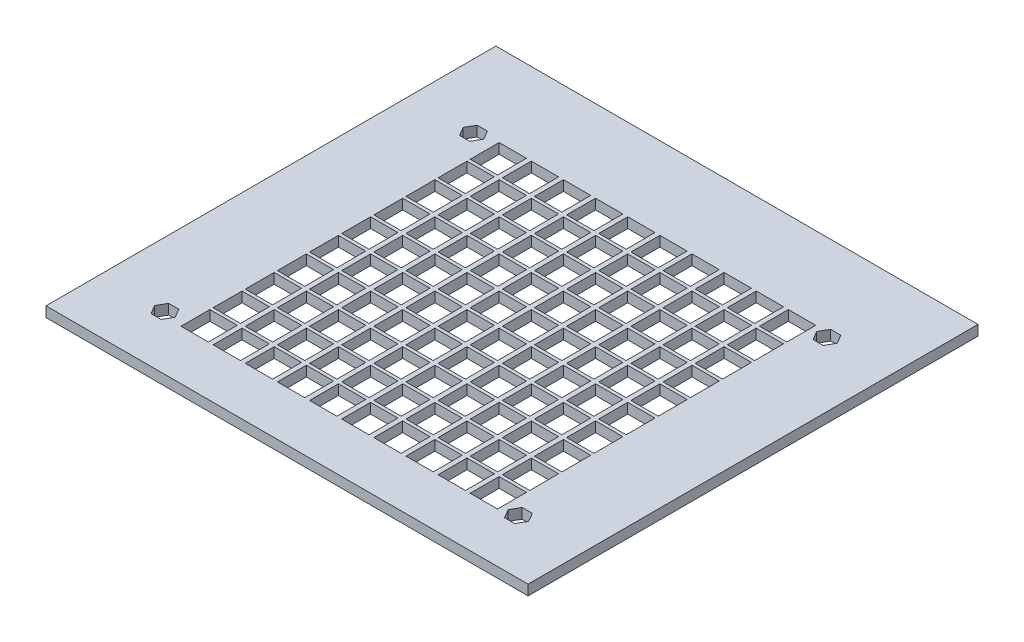
from build123d import *

# Parameters (mm, degrees)
SKETCH1_W           = 8.5
SKETCH1_H           = 9
BOSS_EXTRUDE1_DEPTH = 3.175


with BuildPart() as part:
    # Sketch1 → Boss-Extrude1 (new body)
    with BuildSketch(Plane(origin=(0, 0, 0), x_dir=(1, 0, 0), z_dir=(0, 1, 0))):
        Polygon((0, 106), (0, 0), (0, -12), (150, -12), (150, 0), (150, 106), (150, 128), (0, 128), align=None)
        Polygon((18.41228676, 2.25), (16.824573519, 5), (18.41228676, 7.75), (21.58771324, 7.75), (23.175426481, 5), (21.58771324, 2.25), align=None, mode=Mode.SUBTRACT)
        with Locations((30.75, 8)):
            Rectangle(SKETCH1_W, SKETCH1_H, mode=Mode.SUBTRACT)
        with Locations((30.75, 18)):
            Rectangle(SKETCH1_W, SKETCH1_H, mode=Mode.SUBTRACT)
        with Locations((40.75, 8)):
            Rectangle(SKETCH1_W, SKETCH1_H, mode=Mode.SUBTRACT)
        with Locations((50.75, 8)):
            Rectangle(SKETCH1_W, SKETCH1_H, mode=Mode.SUBTRACT)
        with Locations((40.75, 18)):
            Rectangle(SKETCH1_W, SKETCH1_H, mode=Mode.SUBTRACT)
        with Locations((50.75, 18)):
            Rectangle(SKETCH1_W, SKETCH1_H, mode=Mode.SUBTRACT)
        with Locations((60.75, 8)):
            Rectangle(SKETCH1_W, SKETCH1_H, mode=Mode.SUBTRACT)
        with Locations((70.75, 8)):
            Rectangle(SKETCH1_W, SKETCH1_H, mode=Mode.SUBTRACT)
        with Locations((60.75, 18)):
            Rectangle(SKETCH1_W, SKETCH1_H, mode=Mode.SUBTRACT)
        with Locations((70.75, 18)):
            Rectangle(SKETCH1_W, SKETCH1_H, mode=Mode.SUBTRACT)
        with Locations((30.75, 28)):
            Rectangle(SKETCH1_W, SKETCH1_H, mode=Mode.SUBTRACT)
        with Locations((30.75, 38)):
            Rectangle(SKETCH1_W, SKETCH1_H, mode=Mode.SUBTRACT)
        with Locations((30.75, 48)):
            Rectangle(SKETCH1_W, SKETCH1_H, mode=Mode.SUBTRACT)
        with Locations((30.75, 58)):
            Rectangle(SKETCH1_W, SKETCH1_H, mode=Mode.SUBTRACT)
        with Locations((40.75, 28)):
            Rectangle(SKETCH1_W, SKETCH1_H, mode=Mode.SUBTRACT)
        with Locations((50.75, 28)):
            Rectangle(SKETCH1_W, SKETCH1_H, mode=Mode.SUBTRACT)
        with Locations((40.75, 38)):
            Rectangle(SKETCH1_W, SKETCH1_H, mode=Mode.SUBTRACT)
        with Locations((50.75, 38)):
            Rectangle(SKETCH1_W, SKETCH1_H, mode=Mode.SUBTRACT)
        with Locations((60.75, 28)):
            Rectangle(SKETCH1_W, SKETCH1_H, mode=Mode.SUBTRACT)
        with Locations((70.75, 28)):
            Rectangle(SKETCH1_W, SKETCH1_H, mode=Mode.SUBTRACT)
        with Locations((60.75, 38)):
            Rectangle(SKETCH1_W, SKETCH1_H, mode=Mode.SUBTRACT)
        with Locations((70.75, 38)):
            Rectangle(SKETCH1_W, SKETCH1_H, mode=Mode.SUBTRACT)
        with Locations((40.75, 48)):
            Rectangle(SKETCH1_W, SKETCH1_H, mode=Mode.SUBTRACT)
        with Locations((50.75, 48)):
            Rectangle(SKETCH1_W, SKETCH1_H, mode=Mode.SUBTRACT)
        with Locations((40.75, 58)):
            Rectangle(SKETCH1_W, SKETCH1_H, mode=Mode.SUBTRACT)
        with Locations((50.75, 58)):
            Rectangle(SKETCH1_W, SKETCH1_H, mode=Mode.SUBTRACT)
        with Locations((60.75, 48)):
            Rectangle(SKETCH1_W, SKETCH1_H, mode=Mode.SUBTRACT)
        with Locations((70.75, 48)):
            Rectangle(SKETCH1_W, SKETCH1_H, mode=Mode.SUBTRACT)
        with Locations((60.75, 58)):
            Rectangle(SKETCH1_W, SKETCH1_H, mode=Mode.SUBTRACT)
        with Locations((70.75, 58)):
            Rectangle(SKETCH1_W, SKETCH1_H, mode=Mode.SUBTRACT)
        with Locations((80.75, 8)):
            Rectangle(SKETCH1_W, SKETCH1_H, mode=Mode.SUBTRACT)
        with Locations((90.75, 8)):
            Rectangle(SKETCH1_W, SKETCH1_H, mode=Mode.SUBTRACT)
        with Locations((80.75, 18)):
            Rectangle(SKETCH1_W, SKETCH1_H, mode=Mode.SUBTRACT)
        with Locations((90.75, 18)):
            Rectangle(SKETCH1_W, SKETCH1_H, mode=Mode.SUBTRACT)
        with Locations((100.75, 8)):
            Rectangle(SKETCH1_W, SKETCH1_H, mode=Mode.SUBTRACT)
        with Locations((110.75, 8)):
            Rectangle(SKETCH1_W, SKETCH1_H, mode=Mode.SUBTRACT)
        with Locations((100.75, 18)):
            Rectangle(SKETCH1_W, SKETCH1_H, mode=Mode.SUBTRACT)
        with Locations((110.75, 18)):
            Rectangle(SKETCH1_W, SKETCH1_H, mode=Mode.SUBTRACT)
        Polygon((126.824573519, 5), (128.41228676, 7.75), (131.58771324, 7.75), (133.175426481, 5), (131.58771324, 2.25), (128.41228676, 2.25), align=None, mode=Mode.SUBTRACT)
        with Locations((120.75, 8)):
            Rectangle(SKETCH1_W, SKETCH1_H, mode=Mode.SUBTRACT)
        with Locations((120.75, 18)):
            Rectangle(SKETCH1_W, SKETCH1_H, mode=Mode.SUBTRACT)
        with Locations((80.75, 28)):
            Rectangle(SKETCH1_W, SKETCH1_H, mode=Mode.SUBTRACT)
        with Locations((90.75, 28)):
            Rectangle(SKETCH1_W, SKETCH1_H, mode=Mode.SUBTRACT)
        with Locations((80.75, 38)):
            Rectangle(SKETCH1_W, SKETCH1_H, mode=Mode.SUBTRACT)
        with Locations((90.75, 38)):
            Rectangle(SKETCH1_W, SKETCH1_H, mode=Mode.SUBTRACT)
        with Locations((100.75, 28)):
            Rectangle(SKETCH1_W, SKETCH1_H, mode=Mode.SUBTRACT)
        with Locations((110.75, 28)):
            Rectangle(SKETCH1_W, SKETCH1_H, mode=Mode.SUBTRACT)
        with Locations((100.75, 38)):
            Rectangle(SKETCH1_W, SKETCH1_H, mode=Mode.SUBTRACT)
        with Locations((110.75, 38)):
            Rectangle(SKETCH1_W, SKETCH1_H, mode=Mode.SUBTRACT)
        with Locations((80.75, 48)):
            Rectangle(SKETCH1_W, SKETCH1_H, mode=Mode.SUBTRACT)
        with Locations((90.75, 48)):
            Rectangle(SKETCH1_W, SKETCH1_H, mode=Mode.SUBTRACT)
        with Locations((80.75, 58)):
            Rectangle(SKETCH1_W, SKETCH1_H, mode=Mode.SUBTRACT)
        with Locations((90.75, 58)):
            Rectangle(SKETCH1_W, SKETCH1_H, mode=Mode.SUBTRACT)
        with Locations((100.75, 48)):
            Rectangle(SKETCH1_W, SKETCH1_H, mode=Mode.SUBTRACT)
        with Locations((110.75, 48)):
            Rectangle(SKETCH1_W, SKETCH1_H, mode=Mode.SUBTRACT)
        with Locations((100.75, 58)):
            Rectangle(SKETCH1_W, SKETCH1_H, mode=Mode.SUBTRACT)
        with Locations((110.75, 58)):
            Rectangle(SKETCH1_W, SKETCH1_H, mode=Mode.SUBTRACT)
        with Locations((120.75, 28)):
            Rectangle(SKETCH1_W, SKETCH1_H, mode=Mode.SUBTRACT)
        with Locations((120.75, 38)):
            Rectangle(SKETCH1_W, SKETCH1_H, mode=Mode.SUBTRACT)
        with Locations((120.75, 48)):
            Rectangle(SKETCH1_W, SKETCH1_H, mode=Mode.SUBTRACT)
        with Locations((120.75, 58)):
            Rectangle(SKETCH1_W, SKETCH1_H, mode=Mode.SUBTRACT)
        with Locations((30.75, 68)):
            Rectangle(SKETCH1_W, SKETCH1_H, mode=Mode.SUBTRACT)
        with Locations((30.75, 78)):
            Rectangle(SKETCH1_W, SKETCH1_H, mode=Mode.SUBTRACT)
        with Locations((30.75, 88)):
            Rectangle(SKETCH1_W, SKETCH1_H, mode=Mode.SUBTRACT)
        with Locations((40.75, 68)):
            Rectangle(SKETCH1_W, SKETCH1_H, mode=Mode.SUBTRACT)
        with Locations((50.75, 68)):
            Rectangle(SKETCH1_W, SKETCH1_H, mode=Mode.SUBTRACT)
        with Locations((60.75, 68)):
            Rectangle(SKETCH1_W, SKETCH1_H, mode=Mode.SUBTRACT)
        with Locations((70.75, 68)):
            Rectangle(SKETCH1_W, SKETCH1_H, mode=Mode.SUBTRACT)
        with Locations((40.75, 78)):
            Rectangle(SKETCH1_W, SKETCH1_H, mode=Mode.SUBTRACT)
        with Locations((50.75, 78)):
            Rectangle(SKETCH1_W, SKETCH1_H, mode=Mode.SUBTRACT)
        with Locations((40.75, 88)):
            Rectangle(SKETCH1_W, SKETCH1_H, mode=Mode.SUBTRACT)
        with Locations((50.75, 88)):
            Rectangle(SKETCH1_W, SKETCH1_H, mode=Mode.SUBTRACT)
        with Locations((60.75, 78)):
            Rectangle(SKETCH1_W, SKETCH1_H, mode=Mode.SUBTRACT)
        with Locations((70.75, 78)):
            Rectangle(SKETCH1_W, SKETCH1_H, mode=Mode.SUBTRACT)
        with Locations((60.75, 88)):
            Rectangle(SKETCH1_W, SKETCH1_H, mode=Mode.SUBTRACT)
        with Locations((70.75, 88)):
            Rectangle(SKETCH1_W, SKETCH1_H, mode=Mode.SUBTRACT)
        Polygon((23.175426481, 101), (21.58771324, 98.25), (18.41228676, 98.25), (16.824573519, 101), (18.41228676, 103.75), (21.58771324, 103.75), align=None, mode=Mode.SUBTRACT)
        with Locations((30.75, 98)):
            Rectangle(SKETCH1_W, SKETCH1_H, mode=Mode.SUBTRACT)
        with Locations((40.75, 98)):
            Rectangle(SKETCH1_W, SKETCH1_H, mode=Mode.SUBTRACT)
        with Locations((50.75, 98)):
            Rectangle(SKETCH1_W, SKETCH1_H, mode=Mode.SUBTRACT)
        with Locations((60.75, 98)):
            Rectangle(SKETCH1_W, SKETCH1_H, mode=Mode.SUBTRACT)
        with Locations((70.75, 98)):
            Rectangle(SKETCH1_W, SKETCH1_H, mode=Mode.SUBTRACT)
        with Locations((80.75, 68)):
            Rectangle(SKETCH1_W, SKETCH1_H, mode=Mode.SUBTRACT)
        with Locations((90.75, 68)):
            Rectangle(SKETCH1_W, SKETCH1_H, mode=Mode.SUBTRACT)
        with Locations((100.75, 68)):
            Rectangle(SKETCH1_W, SKETCH1_H, mode=Mode.SUBTRACT)
        with Locations((110.75, 68)):
            Rectangle(SKETCH1_W, SKETCH1_H, mode=Mode.SUBTRACT)
        with Locations((80.75, 78)):
            Rectangle(SKETCH1_W, SKETCH1_H, mode=Mode.SUBTRACT)
        with Locations((90.75, 78)):
            Rectangle(SKETCH1_W, SKETCH1_H, mode=Mode.SUBTRACT)
        with Locations((80.75, 88)):
            Rectangle(SKETCH1_W, SKETCH1_H, mode=Mode.SUBTRACT)
        with Locations((90.75, 88)):
            Rectangle(SKETCH1_W, SKETCH1_H, mode=Mode.SUBTRACT)
        with Locations((100.75, 78)):
            Rectangle(SKETCH1_W, SKETCH1_H, mode=Mode.SUBTRACT)
        with Locations((110.75, 78)):
            Rectangle(SKETCH1_W, SKETCH1_H, mode=Mode.SUBTRACT)
        with Locations((100.75, 88)):
            Rectangle(SKETCH1_W, SKETCH1_H, mode=Mode.SUBTRACT)
        with Locations((110.75, 88)):
            Rectangle(SKETCH1_W, SKETCH1_H, mode=Mode.SUBTRACT)
        with Locations((120.75, 68)):
            Rectangle(SKETCH1_W, SKETCH1_H, mode=Mode.SUBTRACT)
        with Locations((120.75, 78)):
            Rectangle(SKETCH1_W, SKETCH1_H, mode=Mode.SUBTRACT)
        with Locations((120.75, 88)):
            Rectangle(SKETCH1_W, SKETCH1_H, mode=Mode.SUBTRACT)
        with Locations((80.75, 98)):
            Rectangle(SKETCH1_W, SKETCH1_H, mode=Mode.SUBTRACT)
        with Locations((90.75, 98)):
            Rectangle(SKETCH1_W, SKETCH1_H, mode=Mode.SUBTRACT)
        with Locations((100.75, 98)):
            Rectangle(SKETCH1_W, SKETCH1_H, mode=Mode.SUBTRACT)
        with Locations((110.75, 98)):
            Rectangle(SKETCH1_W, SKETCH1_H, mode=Mode.SUBTRACT)
        with Locations((120.75, 98)):
            Rectangle(SKETCH1_W, SKETCH1_H, mode=Mode.SUBTRACT)
        Polygon((126.824573519, 101), (128.41228676, 103.75), (131.58771324, 103.75), (133.175426481, 101), (131.58771324, 98.25), (128.41228676, 98.25), align=None, mode=Mode.SUBTRACT)
    extrude(amount=BOSS_EXTRUDE1_DEPTH)


solid = part.part
